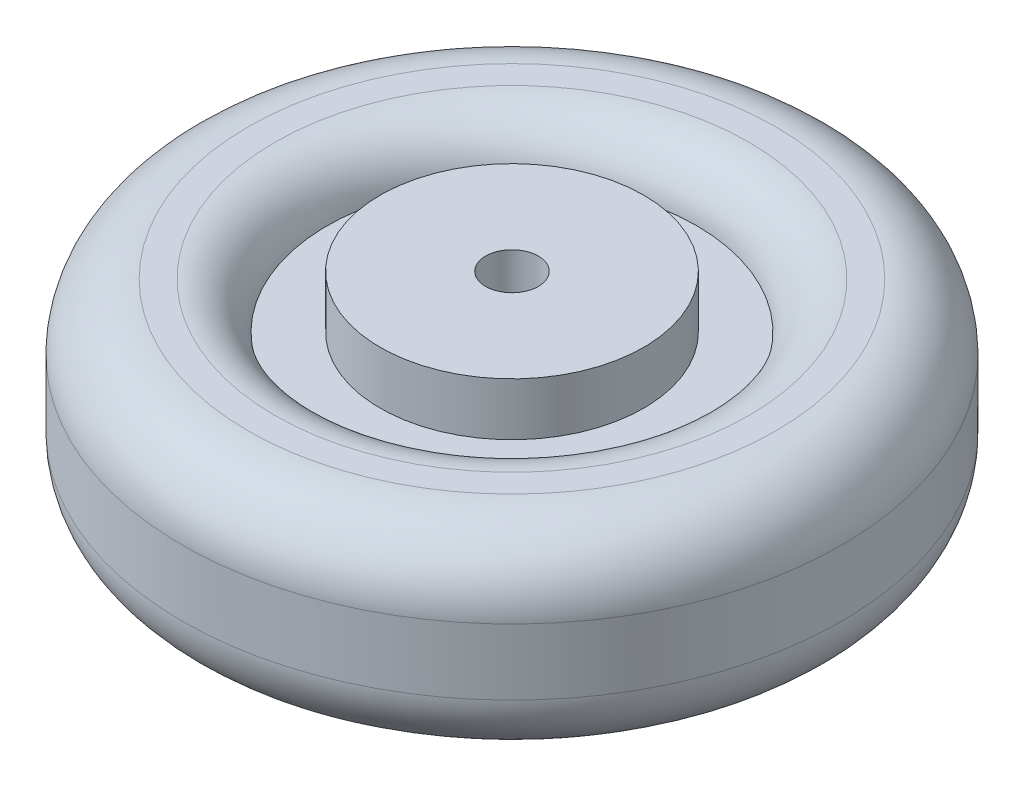
from build123d import *

# Parameters (mm, degrees)
CONG_1_R = 10
CONG_2_R = 8


with BuildPart() as part:
    # Esquisse1 → Révolution1 (revolve)
    with BuildSketch(Plane.XY, mode=Mode.PRIVATE) as r_volution1_sk:
        Polygon((-4, -16), (-4, 16), (-20, 16), (-20, 8), (-28, 8), (-28, 15), (-50, 15), (-50, -15), (-28, -15), (-28, -8), (-20, -8), (-20, -16), align=None)
    revolve(r_volution1_sk.sketch.rotate(Axis((0, 0, 0), (0, 1, 0)), 270), axis=Axis((0, 0, 0), (0, 1, 0)))

    # Congé1
    cong_1_edges = [part.edges().sort_by_distance(p)[0] for p in [
        (0, -15, 50),
        (0, 15, 50),
    ]]
    fillet(cong_1_edges, radius=CONG_1_R)

    # Congé2
    # the kernel refuses this fillet: 8 mm, written as the material it takes off along each edge
    with BuildSketch(Plane(origin=(0, -15, 0), x_dir=(0, 0, -1), z_dir=(1, 0, 0))) as cong_2_piece_1:
        with BuildLine():
            CenterArc((35.937253933, 8), CONG_2_R, 187.180755781, 82.819244219)
            Line((28, 7), (27.841254921, 6.98))
            ThreePointArc((27.841254921, 6.98), (27.84, 3.5), (27.84, 0))
            Line((27.84, 0), (28, -0.16))
            Line((28, -0.16), (35.937253933, -0.16))
            Line((35.937253933, -0.16), (35.937253933, 0))
        make_face()
    revolve(axis=Axis((0, -15, 0), (0, 1, 0)), mode=Mode.SUBTRACT)
    with BuildSketch(Plane(origin=(0, 15, 0), x_dir=(0, 0, -1), z_dir=(1, 0, 0))) as cong_2_piece_2:
        with BuildLine():
            CenterArc((35.937253933, -8), CONG_2_R, 90, 82.819244219)
            Line((28, -7), (27.841254921, -6.98))
            ThreePointArc((27.841254921, -6.98), (27.84, -3.5), (27.84, 0))
            Line((27.84, 0), (28, 0.16))
            Line((28, 0.16), (35.937253933, 0.16))
            Line((35.937253933, 0.16), (35.937253933, 0))
        make_face()
    revolve(axis=Axis((0, 15, 0), (0, 1, 0)), mode=Mode.SUBTRACT)


solid = part.part
